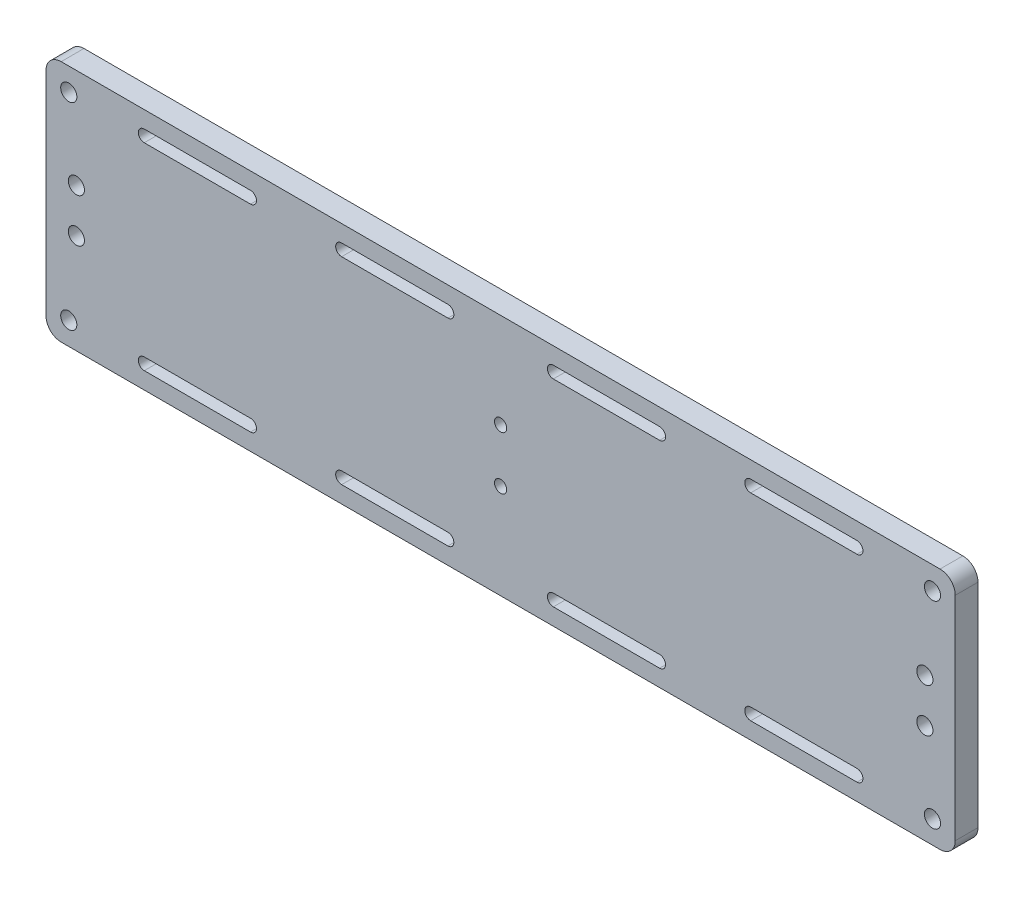
from build123d import *

# Parameters (mm, degrees)
SKETCH1_W                                            = 380.2888
SKETCH1_H                                            = 101.6
BOSS_EXTRUDE1_DEPTH                                  = 9.525
F_10_CLEARANCE_SLOT1_DEPTH                           = 9.525
FILLET1_R                                            = 6.35
CBORE_FOR_1_4_SOCKET_HEAD_CAP_SCREW4_D               = 6.7564
CBORE_FOR_1_4_SOCKET_HEAD_CAP_SCREW4_CBORE_D         = 11.1125
CBORE_FOR_1_4_SOCKET_HEAD_CAP_SCREW4_CBORE_DEPTH     = 3.175
CBORE_FOR_10_SOCKET_HEAD_CAP_SCREW1_D                = 5.1054
CBORE_FOR_10_SOCKET_HEAD_CAP_SCREW1_CBORE_D          = 8.128
CBORE_FOR_10_SOCKET_HEAD_CAP_SCREW1_CBORE_DEPTH      = 2.54
CBORE_FOR_1_4_BINDING_HEAD_MACHINE_SCREW_D           = 6.7564
CBORE_FOR_1_4_BINDING_HEAD_MACHINE_SCREW_DEPTH       = 12.827
CBORE_FOR_1_4_BINDING_HEAD_MACHINE_SCREW_CBORE_D     = 11.1125
CBORE_FOR_1_4_BINDING_HEAD_MACHINE_SCREW_CBORE_DEPTH = 3.175


# Read off the part's stored shape, not the designer's step: #10 Clearance Slot1
with BuildPart() as part:
    # Sketch1 → Boss-Extrude1 (new body)
    with BuildSketch(Plane.XY):
        Rectangle(SKETCH1_W, SKETCH1_H)
    extrude(amount=BOSS_EXTRUDE1_DEPTH)

    # #10 Clearance Slot1 outline → #10 Clearance Slot1 (cut)
    with BuildSketch(Plane.XY):
        with BuildLine():
            Line((-149.0472, 38.7858), (-104.5972, 38.7858))
            ThreePointArc((-104.5972, 38.7858), (-102.108, 41.275), (-104.5972, 43.7642))
            Line((-104.5972, 43.7642), (-149.0472, 43.7642))
            ThreePointArc((-149.0472, 43.7642), (-151.5364, 41.275), (-149.0472, 38.7858))
        make_face()
        with BuildLine():
            ThreePointArc((-22.0472, 38.7858), (-19.558, 41.275), (-22.0472, 43.7642))
            Line((-22.0472, 43.7642), (-66.4972, 43.7642))
            ThreePointArc((-66.4972, 43.7642), (-68.9864, 41.275), (-66.4972, 38.7858))
            Line((-66.4972, 38.7858), (-22.0472, 38.7858))
        make_face()
        with BuildLine():
            ThreePointArc((66.4972, 38.7858), (68.9864, 41.275), (66.4972, 43.7642))
            Line((66.4972, 43.7642), (22.0472, 43.7642))
            ThreePointArc((22.0472, 43.7642), (19.558, 41.275), (22.0472, 38.7858))
            Line((22.0472, 38.7858), (66.4972, 38.7858))
        make_face()
        with BuildLine():
            ThreePointArc((149.0472, 38.7858), (151.5364, 41.275), (149.0472, 43.7642))
            Line((149.0472, 43.7642), (104.5972, 43.7642))
            ThreePointArc((104.5972, 43.7642), (102.108, 41.275), (104.5972, 38.7858))
            Line((104.5972, 38.7858), (149.0472, 38.7858))
        make_face()
        with BuildLine():
            Line((104.5972, -43.7642), (149.0472, -43.7642))
            ThreePointArc((149.0472, -43.7642), (151.5364, -41.275), (149.0472, -38.7858))
            Line((149.0472, -38.7858), (104.5972, -38.7858))
            ThreePointArc((104.5972, -38.7858), (102.108, -41.275), (104.5972, -43.7642))
        make_face()
        with BuildLine():
            ThreePointArc((66.4972, -43.7642), (68.9864, -41.275), (66.4972, -38.7858))
            Line((66.4972, -38.7858), (22.0472, -38.7858))
            ThreePointArc((22.0472, -38.7858), (19.558, -41.275), (22.0472, -43.7642))
            Line((22.0472, -43.7642), (66.4972, -43.7642))
        make_face()
        with BuildLine():
            ThreePointArc((-22.0472, -43.7642), (-19.558, -41.275), (-22.0472, -38.7858))
            Line((-22.0472, -38.7858), (-66.4972, -38.7858))
            ThreePointArc((-66.4972, -38.7858), (-68.9864, -41.275), (-66.4972, -43.7642))
            Line((-66.4972, -43.7642), (-22.0472, -43.7642))
        make_face()
        with BuildLine():
            ThreePointArc((-104.5972, -43.7642), (-102.108, -41.275), (-104.5972, -38.7858))
            Line((-104.5972, -38.7858), (-149.0472, -38.7858))
            ThreePointArc((-149.0472, -38.7858), (-151.5364, -41.275), (-149.0472, -43.7642))
            Line((-149.0472, -43.7642), (-104.5972, -43.7642))
        make_face()
    extrude(amount=F_10_CLEARANCE_SLOT1_DEPTH, mode=Mode.SUBTRACT)

    # Fillet1
    fillet1_edges = [part.edges().sort_by_distance(p)[0] for p in [
        (-190.1444, 50.8, 4.7625),
        (190.1444, 50.8, 4.7625),
        (190.1444, -50.8, 4.7625),
        (-190.1444, -50.8, 4.7625),
    ]]
    fillet(fillet1_edges, radius=FILLET1_R)

    # CBORE for 1/4 Socket Head Cap Screw4 (through all)
    with Locations(Plane(origin=(0, 0, 0), x_dir=(-1, 0, 0), z_dir=(0, 0, -1))):
        with Locations((-177.4444, 9.144), (-177.4444, -9.144), (177.4444, 9.144), (177.4444, -9.144)):
            CounterBoreHole(CBORE_FOR_1_4_SOCKET_HEAD_CAP_SCREW4_D / 2, CBORE_FOR_1_4_SOCKET_HEAD_CAP_SCREW4_CBORE_D / 2, CBORE_FOR_1_4_SOCKET_HEAD_CAP_SCREW4_CBORE_DEPTH)

    # CBORE for #10 Socket Head Cap Screw1 (through all)
    with Locations(Plane(origin=(0, 0, 0), x_dir=(-1, 0, 0), z_dir=(0, 0, -1))):
        with Locations((0, 11.1125), (0, -11.1125)):
            CounterBoreHole(CBORE_FOR_10_SOCKET_HEAD_CAP_SCREW1_D / 2, CBORE_FOR_10_SOCKET_HEAD_CAP_SCREW1_CBORE_D / 2, CBORE_FOR_10_SOCKET_HEAD_CAP_SCREW1_CBORE_DEPTH)

    # CBORE for 1/4 Binding Head Machine Screw1
    with Locations(Plane(origin=(0, 0, 0), x_dir=(-1, 0, 0), z_dir=(0, 0, -1))):
        with Locations((180.6194, 41.275), (180.6194, -41.275), (-180.6194, 41.275), (-180.6194, -41.275)):
            CounterBoreHole(CBORE_FOR_1_4_BINDING_HEAD_MACHINE_SCREW_D / 2, CBORE_FOR_1_4_BINDING_HEAD_MACHINE_SCREW_CBORE_D / 2, CBORE_FOR_1_4_BINDING_HEAD_MACHINE_SCREW_CBORE_DEPTH, depth=CBORE_FOR_1_4_BINDING_HEAD_MACHINE_SCREW_DEPTH)


solid = part.part
